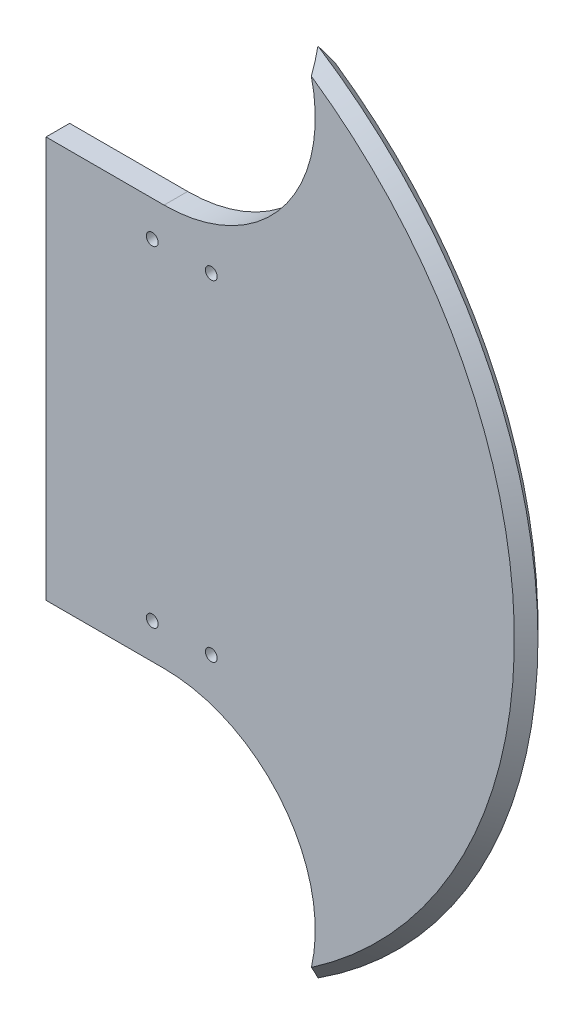
from build123d import *

# Parameters (mm, degrees)
EXTRUDE_1_DEPTH     = 10
CHAMFER_2_SIZE      = 5
SKETCH_2_R          = 2.5
CUT_EXTRUDE_1_DEPTH = 30


with BuildPart() as part:
    # Эскиз1 → Бобышка-Вытянуть1 (new body)
    with BuildSketch(Plane.XY):
        with BuildLine():
            Line((0, -85), (0, 85))
            Line((0, 85), (50, 85))
            ThreePointArc((50, 85), (102.466768683, 112.312471025), (110.187404416, 170.956521648))
            ThreePointArc((110.187404416, 170.956521648), (203.389764703, 0), (110.187404416, -170.956521648))
            ThreePointArc((110.187404416, -170.956521648), (102.466768683, -112.312471025), (50, -85))
            Line((50, -85), (0, -85))
        make_face()
    extrude(amount=EXTRUDE_1_DEPTH)

    # Фаска2
    chamfer_2_edges = [part.edges().sort_by_distance(p)[0] for p in [
        (203.389764703, 0, 0),
        (203.389764703, 0, 10),
    ]]
    chamfer(chamfer_2_edges, length=CHAMFER_2_SIZE - 0.0001)  # a hair under: the kernel refuses the full size

    # Эскиз2 → Вырез-Вытянуть1 (cut)
    with BuildSketch(Plane.XY.offset(10)):
        with Locations((45, -70)):
            Circle(SKETCH_2_R)
        with Locations((70, -70)):
            Circle(SKETCH_2_R)
        with Locations((70, 70)):
            Circle(SKETCH_2_R)
        with Locations((45, 70)):
            Circle(SKETCH_2_R)
    extrude(amount=-CUT_EXTRUDE_1_DEPTH, mode=Mode.SUBTRACT)


solid = part.part
